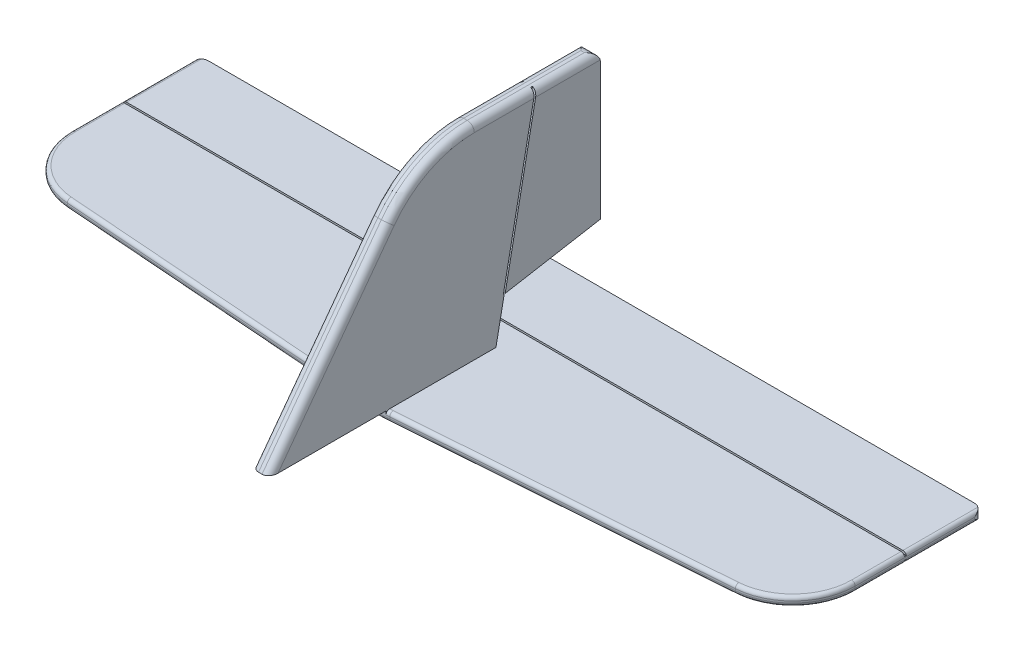
from build123d import *

# Parameters (mm, degrees)
BOSS_EXTRUDE1_DEPTH = 5
CUT_EXTRUDE1_DEPTH  = 2.5
FILLET1_R           = 4
SKETCH4_W           = 220
SKETCH4_H           = 0.5
BOSS_EXTRUDE2_DEPTH = 5
FILLET2_R           = 94
SKETCH4_3_W         = 220
SKETCH4_3_H         = 0.5
CUT_EXTRUDE2_DEPTH  = 1.5
FILLET3_R           = 2


with BuildPart() as part:
    # Sketch1 → Boss-Extrude1 (new, symmetric)
    with BuildSketch(Plane(origin=(0, 0, 0), x_dir=(0, 0, -1), z_dir=(1, 0, 0))):
        with BuildLine():
            Line((-186, 0), (-58.646559411, 0))
            Line((-58.646559411, 0), (-54.001298593, 23.576272927))
            Line((-54.001298593, 23.576272927), (-36.080578642, 114.53))
            Line((-36.080578642, 114.53), (-70.810980212, 114.53))
            ThreePointArc((-70.810980212, 114.53), (-97.778791842, 108.127921004), (-118.991601457, 90.28790453))
            Line((-118.991601457, 90.28790453), (-186, 0))
        make_face()
        with BuildLine():
            Line((-54.001298593, 23.576272927), (0, 33.038472112))
            Line((0, 33.038472112), (0, 109.53))
            ThreePointArc((0, 109.53), (-1.464466094, 113.065533906), (-5, 114.53))
            Line((-5, 114.53), (-36.080578642, 114.53))
            Line((-36.080578642, 114.53), (-54.001298593, 23.576272927))
        make_face()
    extrude(amount=BOSS_EXTRUDE1_DEPTH, both=True)

    # Sketch3 → Cut-Extrude1 (cut)
    with BuildSketch(Plane(origin=(5, 0, 0), x_dir=(0, 0, -1), z_dir=(1, 0, 0))):
        Polygon((-36.080578642, 114.53), (-54.001298593, 23.576272927), (-53.473462597, 23.668761246), (-35.570965729, 114.53), align=None)
        Polygon((-54.501298593, 23.576272927), (-54.001298593, 23.576272927), (-36.080578642, 114.53), (-36.580578642, 114.53), align=None)
    cut_extrude1 = extrude(amount=-CUT_EXTRUDE1_DEPTH, mode=Mode.SUBTRACT)

    # Mirror1: Cut-Extrude1 across plane
    add(cut_extrude1.mirror(Plane(origin=(0, 0, 0), x_dir=(0, 0, 1), z_dir=(1, 0, 0))), mode=Mode.SUBTRACT)

    # Fillet1
    # the kernel refuses this fillet: 4 mm, written as the material it takes off along each edge
    with BuildSketch(Plane(origin=(5, 90.28790453, 118.991601457), x_dir=(0, -0.5959650755061177, -0.8030103540907723), z_dir=(0, -0.8030103540907724, 0.5959650755061177))) as fillet1_piece_1:
        with BuildLine():
            CenterArc((FILLET1_R, -FILLET1_R), FILLET1_R, 90, 90)
            Line((0, -FILLET1_R), (0, 0))
            Line((0, 0), (FILLET1_R, 0))
        make_face()
    extrude(amount=122.436787484, mode=Mode.SUBTRACT)
    with BuildSketch(Plane(origin=(-5, 90.28790453, 118.991601457), x_dir=(0, -0.5959650755061177, -0.8030103540907723), z_dir=(0, -0.8030103540907724, 0.5959650755061177))) as fillet1_piece_2:
        with BuildLine():
            CenterArc((FILLET1_R, FILLET1_R), FILLET1_R, 180, 90)
            Line((0, FILLET1_R), (0, 0))
            Line((0, 0), (FILLET1_R, 0))
        make_face()
    extrude(amount=122.436787484, mode=Mode.SUBTRACT)
    with BuildSketch(Plane(origin=(-5, 54.53, 70.810980212), x_dir=(0, 1, 0), z_dir=(0, 0, -1))) as fillet1_piece_3:
        with BuildLine():
            CenterArc((60 - FILLET1_R, FILLET1_R), FILLET1_R, 270, 90)
            Line((60, FILLET1_R), (60, 0))
            Line((60, 0), (60 - FILLET1_R, 0))
        make_face()
    revolve(axis=Axis((-5, 54.53, 70.810980212), (1, 0, 0)), revolution_arc=53.418539238, mode=Mode.SUBTRACT)
    with BuildSketch(Plane(origin=(5, 114.53, -5), x_dir=(-1, 0, 0), z_dir=(0, 0, 1)), Plane(origin=(-5, 114.53, 45.570965729), x_dir=(1, 0, 0), z_dir=(0, 0, -1))) as fillet1_piece_4:
        with BuildLine():
            CenterArc((FILLET1_R, FILLET1_R), FILLET1_R, 180, 90)
            Line((0, FILLET1_R), (0, 0))
            Line((0, 0), (FILLET1_R, 0))
        make_face()
    extrude(amount=50.570965729, mode=Mode.SUBTRACT)
    with BuildSketch(Plane(origin=(5, 114.53, 26.580578642), x_dir=(0, -1, 0), z_dir=(0, 0, 1)), Plane(origin=(-5, 114.53, 70.810980212), x_dir=(0, -1, 0), z_dir=(0, 0, -1))) as fillet1_piece_5:
        with BuildLine():
            CenterArc((FILLET1_R, -FILLET1_R), FILLET1_R, 90, 90)
            Line((0, -FILLET1_R), (0, 0))
            Line((0, 0), (FILLET1_R, 0))
        make_face()
    extrude(amount=44.23040157, mode=Mode.SUBTRACT)
    with BuildSketch(Plane(origin=(5, 54.53, 70.810980212), x_dir=(0, 1, 0), z_dir=(0, 0, -1))) as fillet1_piece_6:
        with BuildLine():
            CenterArc((60 - FILLET1_R, -FILLET1_R), FILLET1_R, 0, 90)
            Line((60, -FILLET1_R), (60, 0))
            Line((60, 0), (60 - FILLET1_R, 0))
        make_face()
    revolve(axis=Axis((5, 54.53, 70.810980212), (1, 0, 0)), revolution_arc=53.418539238, mode=Mode.SUBTRACT)

    # Sketch4 → Boss-Extrude2 (add)
    with BuildSketch(Plane(origin=(0, 0, 0), x_dir=(1, 0, 0), z_dir=(0, 1, 0))):
        with BuildLine():
            Line((0, -120.786991444), (0, -44.112479236))
            Line((0, -44.112479236), (-220, -44.112479236))
            Line((-220, -44.112479236), (-220, -71.868268015))
            ThreePointArc((-220, -71.868268015), (-210.65408653, -95.677254644), (-187.607551754, -106.770999625))
            Line((-187.607551754, -106.770999625), (0, -120.786991444))
        make_face()
        with Locations((-110, -43.862479236)):
            Rectangle(SKETCH4_W, SKETCH4_H)
        with Locations((-110, -43.362479236)):
            Rectangle(SKETCH4_W, SKETCH4_H)
        with BuildLine():
            Line((0, -43.112479236), (0, 0))
            Line((0, 0), (-215, 0))
            ThreePointArc((-215, 0), (-218.535533906, -1.464466094), (-220, -5))
            Line((-220, -5), (-220, -43.112479236))
            Line((-220, -43.112479236), (0, -43.112479236))
        make_face()
        with BuildLine():
            Line((220, -44.112479236), (0, -44.112479236))
            Line((0, -44.112479236), (0, -120.786991444))
            Line((0, -120.786991444), (187.607551754, -106.770999625))
            ThreePointArc((187.607551754, -106.770999625), (210.65408653, -95.677254644), (220, -71.868268015))
            Line((220, -71.868268015), (220, -44.112479236))
        make_face()
        with Locations((110, -43.862479236)):
            Rectangle(SKETCH4_W, SKETCH4_H)
        with Locations((110, -43.362479236)):
            Rectangle(SKETCH4_W, SKETCH4_H)
        with BuildLine():
            Line((215, 0), (0, 0))
            Line((0, 0), (0, -43.112479236))
            Line((0, -43.112479236), (220, -43.112479236))
            Line((220, -43.112479236), (220, -5))
            ThreePointArc((220, -5), (218.535533906, -1.464466094), (215, 0))
        make_face()
    extrude(amount=-BOSS_EXTRUDE2_DEPTH)

    # Fillet2
    # the kernel refuses this fillet: 94 mm, written as the material it takes off along each edge
    with BuildSketch(Plane(origin=(0, 0, 120.786991444), x_dir=(0.9972209031466417, 0, -0.07450147869268323), z_dir=(0, -1, 0))) as fillet2_piece_1:
        with BuildLine():
            CenterArc((FILLET2_R * 0.0747091025244, -FILLET2_R), FILLET2_R, 90, 8.545158001)
            Line((-FILLET2_R * 0.0738797612109, -FILLET2_R * 0.0111009406548), (0, 0))
            Line((0, 0), (FILLET2_R * 0.0747091025244, 0))
        make_face()
    extrude(amount=22.556639093, mode=Mode.SUBTRACT)

    # Sketch4<3> → Cut-Extrude2 (cut)
    with BuildSketch(Plane(origin=(0, 0, 0), x_dir=(1, 0, 0), z_dir=(0, 1, 0))):
        with Locations((110, -43.362479236)):
            Rectangle(SKETCH4_3_W, SKETCH4_3_H)
        with Locations((110, -43.862479236)):
            Rectangle(SKETCH4_3_W, SKETCH4_3_H)
        with Locations((-110, -43.862479236)):
            Rectangle(SKETCH4_3_W, SKETCH4_3_H)
        with Locations((-110, -43.362479236)):
            Rectangle(SKETCH4_3_W, SKETCH4_3_H)
    cut_extrude2 = extrude(amount=-CUT_EXTRUDE2_DEPTH, mode=Mode.SUBTRACT)

    # Mirror2: Cut-Extrude2 across plane
    add(cut_extrude2.mirror(Plane.ZX.offset(-2.5)), mode=Mode.SUBTRACT)

    # Fillet3
    # the kernel refuses this fillet: 2 mm, written as the material it takes off along each edge
    with BuildSketch(Plane(origin=(-220, 0, 0), x_dir=(0, -1, 0), z_dir=(0, 0, 1)), Plane(origin=(220, 0, 48.112479236), x_dir=(0, -1, 0), z_dir=(0, 0, -1)), Plane(origin=(-220, -5, 48.112479236), x_dir=(0, 1, 0), z_dir=(0, 0, -1))) as fillet3_piece_1:
        with BuildLine():
            CenterArc((FILLET3_R, FILLET3_R), FILLET3_R, 180, 90)
            Line((0, FILLET3_R), (0, 0))
            Line((0, 0), (FILLET3_R, 0))
        make_face()
    extrude(amount=48.112479236, mode=Mode.SUBTRACT)
    with BuildSketch(Plane(origin=(-185, 0, 71.868268015), x_dir=(-1, 0, 0), z_dir=(0, 0, -1))) as fillet3_piece_2:
        with BuildLine():
            CenterArc((35 - FILLET3_R, -FILLET3_R), FILLET3_R, 0, 90)
            Line((35, -FILLET3_R), (35, 0))
            Line((35, 0), (35 - FILLET3_R, 0))
        make_face()
    revolve(axis=Axis((-185, 0, 71.868268015), (0, 1, 0)), revolution_arc=85.727420999, mode=Mode.SUBTRACT)
    with BuildSketch(Plane(origin=(-187.607551754, 0, 106.770999625), x_dir=(0.07450147869268282, 0, -0.9972209031466417), z_dir=(0.9972209031466417, 0, 0.07450147869268281)), Plane(origin=(7.003138997, 0, 120.263793214), x_dir=(-0.07450147869268252, 0, -0.9972209031466418), z_dir=(0.9972209031466418, 0, -0.07450147869268252)), Plane(origin=(-187.607551754, -5, 106.770999625), x_dir=(0, 1, 0), z_dir=(0.9972209031466417, 0, 0.07450147869268281))) as fillet3_piece_3:
        with BuildLine():
            CenterArc((FILLET3_R, -FILLET3_R), FILLET3_R, 90, 90)
            Line((0, -FILLET3_R), (0, 0))
            Line((0, 0), (FILLET3_R, 0))
        make_face()
    extrude(amount=181.107728676, mode=Mode.SUBTRACT)
    with BuildSketch(Plane(origin=(185, 0, 71.868268015), x_dir=(0.07450147869267976, 0, 0.997220903146642), z_dir=(-0.997220903146642, 0, 0.07450147869267976))) as fillet3_piece_4:
        with BuildLine():
            CenterArc((35 - FILLET3_R, -FILLET3_R), FILLET3_R, 0, 90)
            Line((35, -FILLET3_R), (35, 0))
            Line((35, 0), (35 - FILLET3_R, 0))
        make_face()
    revolve(axis=Axis((185, 0, 71.868268015), (0, 1, 0)), revolution_arc=85.727420999, mode=Mode.SUBTRACT)
    with BuildSketch(Plane(origin=(-185, -5, 71.868268015), x_dir=(-1, 0, 0), z_dir=(0, 0, -1))) as fillet3_piece_5:
        with BuildLine():
            CenterArc((35 - FILLET3_R, FILLET3_R), FILLET3_R, 270, 90)
            Line((35, FILLET3_R), (35, 0))
            Line((35, 0), (35 - FILLET3_R, 0))
        make_face()
    revolve(axis=Axis((-185, -5, 71.868268015), (0, 1, 0)), revolution_arc=85.727420999, mode=Mode.SUBTRACT)
    with BuildSketch(Plane(origin=(220, -5, 48.112479236), x_dir=(0, 1, 0), z_dir=(0, 0, -1))) as fillet3_piece_6:
        with BuildLine():
            CenterArc((FILLET3_R, -FILLET3_R), FILLET3_R, 90, 90)
            Line((0, -FILLET3_R), (0, 0))
            Line((0, 0), (FILLET3_R, 0))
        make_face()
    extrude(amount=48.112479236, mode=Mode.SUBTRACT)
    with BuildSketch(Plane(origin=(185, -5, 71.868268015), x_dir=(0.07450147869267976, 0, 0.997220903146642), z_dir=(-0.997220903146642, 0, 0.07450147869267976))) as fillet3_piece_7:
        with BuildLine():
            CenterArc((35 - FILLET3_R, FILLET3_R), FILLET3_R, 270, 90)
            Line((35, FILLET3_R), (35, 0))
            Line((35, 0), (35 - FILLET3_R, 0))
        make_face()
    revolve(axis=Axis((185, -5, 71.868268015), (0, 1, 0)), revolution_arc=85.727420999, mode=Mode.SUBTRACT)
    with BuildSketch(Plane(origin=(7.003138997, -5, 120.263793214), x_dir=(-0.07450147869268252, 0, -0.9972209031466418), z_dir=(0.9972209031466418, 0, -0.07450147869268252))) as fillet3_piece_8:
        with BuildLine():
            CenterArc((FILLET3_R, FILLET3_R), FILLET3_R, 180, 90)
            Line((0, FILLET3_R), (0, 0))
            Line((0, 0), (FILLET3_R, 0))
        make_face()
    extrude(amount=181.107728676, mode=Mode.SUBTRACT)
    with BuildSketch(Plane(origin=(0, 0, 26.525028319), x_dir=(0.07450147869297168, 0, 0.9972209031466202), z_dir=(0.9972209031466202, 0, -0.07450147869297168))) as fillet3_piece_9_section:
        with BuildLine():
            CenterArc((94 - FILLET3_R, FILLET3_R), FILLET3_R, 270, 90)
            Line((94 - FILLET3_R, 0), (94, 0))
            Line((94, 0), (94, FILLET3_R))
        make_face()
    fillet3_piece_9 = revolve(axis=Axis((0, 0, 26.525028319), (0, -1, 0)), revolution_arc=4.271140258, mode=Mode.PRIVATE)
    fillet3_piece_9 = split(fillet3_piece_9, bisect_by=Plane(origin=(5, 0, 26.525028319), z_dir=(1, 0, 0)), keep=Keep.TOP, mode=Mode.PRIVATE)
    add(fillet3_piece_9, mode=Mode.SUBTRACT)
    with BuildSketch(Plane(origin=(0, 0, 26.525028319), x_dir=(-2.511079423467498e-05, 0, 0.999999999684724), z_dir=(0.999999999684724, 0, 2.511079423467498e-05))) as fillet3_piece_10_section:
        with BuildLine():
            CenterArc((94 - FILLET3_R, FILLET3_R), FILLET3_R, 270, 90)
            Line((94 - FILLET3_R, 0), (94, 0))
            Line((94, 0), (94, FILLET3_R))
        make_face()
    fillet3_piece_10 = revolve(axis=Axis((0, 0, 26.525028319), (0, -1, 0)), revolution_arc=4.271140258, mode=Mode.PRIVATE)
    fillet3_piece_10 = split(fillet3_piece_10, bisect_by=Plane(origin=(-5, 0, 26.525028319), z_dir=(-1, 0, 0)), keep=Keep.TOP, mode=Mode.PRIVATE)
    add(fillet3_piece_10, mode=Mode.SUBTRACT)
    with BuildSketch(Plane(origin=(0, -5, 26.525028319), x_dir=(-0.07450147869238784, 0, 0.9972209031466637), z_dir=(-0.9972209031466637, 0, -0.07450147869238784))) as fillet3_piece_11:
        with BuildLine():
            CenterArc((94 - FILLET3_R, FILLET3_R), FILLET3_R, 270, 90)
            Line((94 - FILLET3_R, 0), (94, 0))
            Line((94, 0), (94, FILLET3_R))
        make_face()
    revolve(axis=Axis((0, -5, 26.525028319), (0, 1, 0)), revolution_arc=8.545158001, mode=Mode.SUBTRACT)
    with BuildSketch(Plane(origin=(-220, 0, 39.112479236), x_dir=(1, 0, 0), z_dir=(0, 0, 1)), Plane(origin=(220, 0, 71.868268015), x_dir=(-1, 0, 0), z_dir=(0, 0, -1)), Plane(origin=(-220, -5, 71.868268015), x_dir=(1, 0, 0), z_dir=(0, 0, -1))) as fillet3_piece_12:
        with BuildLine():
            CenterArc((FILLET3_R, -FILLET3_R), FILLET3_R, 90, 90)
            Line((0, -FILLET3_R), (0, 0))
            Line((0, 0), (FILLET3_R, 0))
        make_face()
    extrude(amount=32.755788779, mode=Mode.SUBTRACT)
    with BuildSketch(Plane(origin=(220, -5, 71.868268015), x_dir=(-1, 0, 0), z_dir=(0, 0, -1))) as fillet3_piece_13:
        with BuildLine():
            CenterArc((FILLET3_R, FILLET3_R), FILLET3_R, 180, 90)
            Line((0, FILLET3_R), (0, 0))
            Line((0, 0), (FILLET3_R, 0))
        make_face()
    extrude(amount=32.755788779, mode=Mode.SUBTRACT)


solid = part.part
